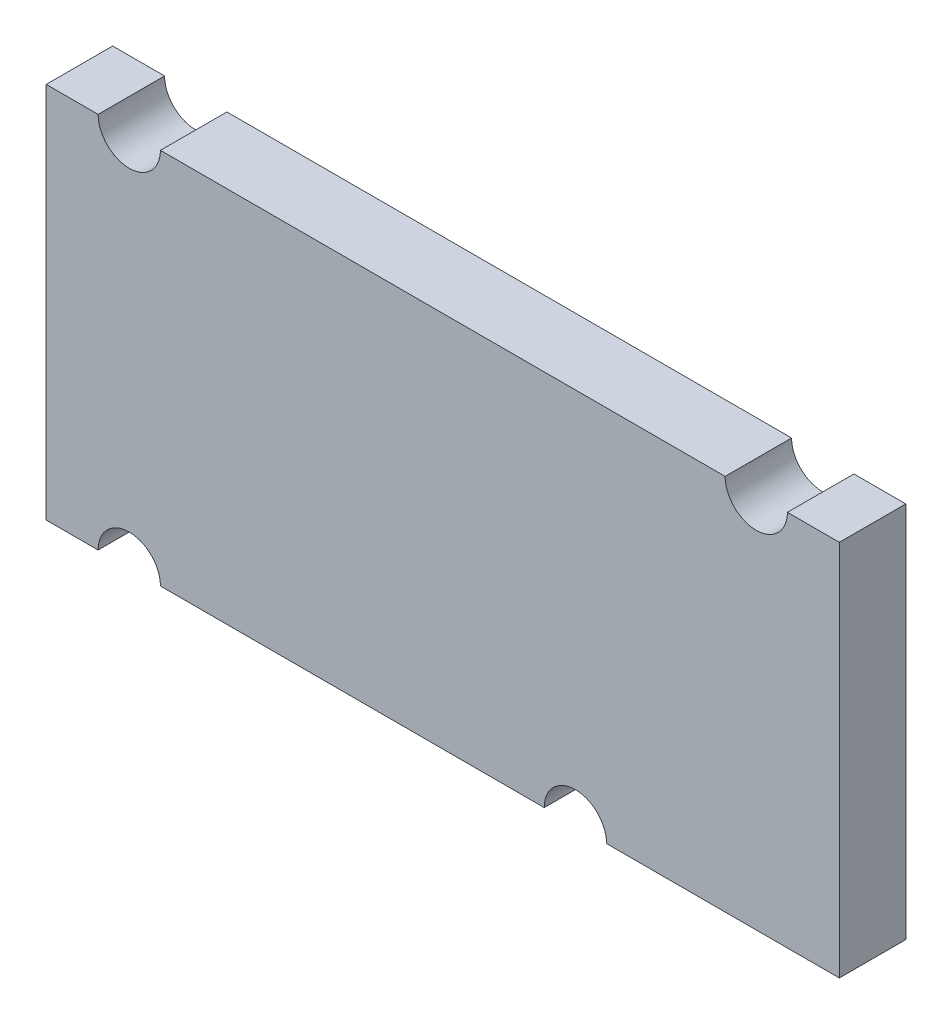
from build123d import *

# Parameters (mm, degrees)
EXTRUDE_1_DEPTH = 4


with BuildPart() as part:
    # 草图1 → 凸台-拉伸1 (new body)
    with BuildSketch(Plane.XY):
        with BuildLine():
            Line((-16.989749635, 11.355), (-20.114749635, 11.355))
            Line((-20.114749635, 11.355), (-20.114749635, -11.355))
            Line((-20.114749635, -11.355), (-16.989749635, -11.355))
            ThreePointArc((-16.989749635, -11.355), (-15.114749635, -9.48), (-13.239749635, -11.355))
            Line((-13.239749635, -11.355), (9.860250365, -11.355))
            ThreePointArc((9.860250365, -11.355), (11.735250365, -9.48), (13.610250365, -11.355))
            Line((13.610250365, -11.355), (27.621850365, -11.355))
            Line((27.621850365, -11.355), (27.621850365, 11.355))
            Line((27.621850365, 11.355), (24.496850365, 11.355))
            ThreePointArc((24.496850365, 11.355), (22.621850365, 9.48), (20.746850365, 11.355))
            Line((20.746850365, 11.355), (-13.239749635, 11.355))
            ThreePointArc((-13.239749635, 11.355), (-15.114749635, 9.48), (-16.989749635, 11.355))
        make_face()
    extrude(amount=EXTRUDE_1_DEPTH)


solid = part.part
